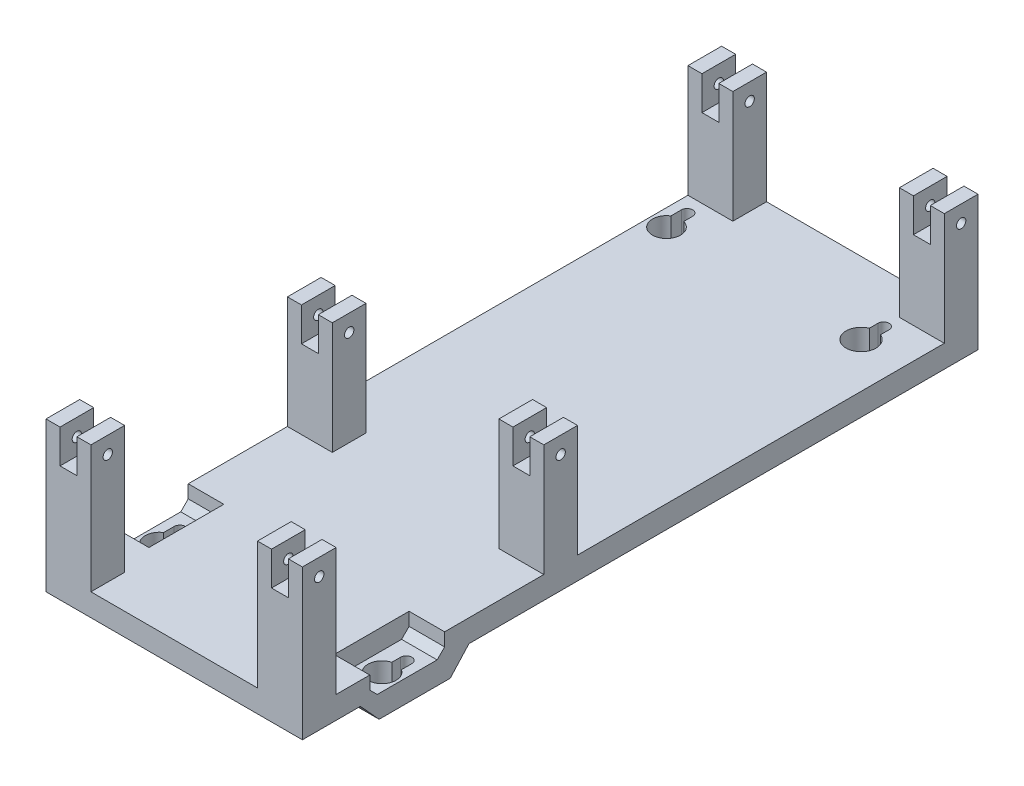
from build123d import *
from OCP.BRepFilletAPI import BRepFilletAPI_MakeChamfer

# Parameters (mm, degrees)
SKETCH1_W           = 68.5
SKETCH1_H           = 64.5
BOSS_EXTRUDE3_DEPTH = 21
SKETCH3_W           = 61.5
SKETCH3_H           = 61
CUT_EXTRUDE1_DEPTH  = 15
SKETCH5_W           = 68.5
SKETCH5_H           = 6
BOSS_EXTRUDE4_DEPTH = 105
SKETCH10_W          = 10
SKETCH10_H          = 29
BOSS_EXTRUDE5_DEPTH = 5.5
SKETCH9_W           = 3.5
SKETCH9_H           = 20
CUT_EXTRUDE2_DEPTH  = 20.5
SKETCH11_W          = 6
SKETCH11_H          = 20
CUT_EXTRUDE3_DEPTH  = 5.5
CHAMFER2_SIZE       = 5.5
CHAMFER2_SIZE_2     = 5
CHAMFER3_SIZE       = 2
SKETCH12_W          = 34.25
SKETCH12_H          = 169.5
CUT_EXTRUDE4_DEPTH  = 50
SKETCH15_R          = 1.5
CUT_EXTRUDE5_DEPTH  = 50
SKETCH19_W          = 34.25
SKETCH19_H          = 6
BOSS_EXTRUDE6_DEPTH = 11
SKETCH26_W          = 12
SKETCH26_H          = 9
BOSS_EXTRUDE7_DEPTH = 30
SKETCH20_R          = 3.75
CUT_EXTRUDE9_DEPTH  = 188.119113134
SKETCH21_W          = 3
SKETCH21_H          = 2.806985986
CUT_EXTRUDE10_DEPTH = 188.119113134
SKETCH18_R          = 1.5
CUT_EXTRUDE8_DEPTH  = 135
SKETCH24_R          = 4
CUT_EXTRUDE13_DEPTH = 196.377839071
SKETCH25_W          = 3
SKETCH25_H          = 3.218590937
CUT_EXTRUDE14_DEPTH = 196.377839071
SKETCH33_R          = 1.5
CUT_EXTRUDE17_DEPTH = 9.74
SKETCH34_R          = 3.75
CUT_EXTRUDE18_DEPTH = 196.377839071
SKETCH39_W          = 3
SKETCH39_H          = 4.471117771
CUT_EXTRUDE22_DEPTH = 196.377839071
CUT_EXTRUDE23_DEPTH = 15
SKETCH41_W          = 4.5
SKETCH41_H          = 9
CUT_EXTRUDE24_DEPTH = 9
SKETCH42_R          = 1.25
CUT_EXTRUDE25_DEPTH = 197.388645293
SKETCH43_W          = 12
SKETCH43_H          = 9
BOSS_EXTRUDE8_DEPTH = 4
SKETCH44_W          = 4.5
SKETCH44_H          = 9
CUT_EXTRUDE26_DEPTH = 9
SKETCH45_R          = 1.25
CUT_EXTRUDE27_DEPTH = 198.16110164


with BuildPart() as part:
    # Sketch1 → Boss-Extrude3 (new body)
    with BuildSketch(Plane(origin=(0, 0, 0), x_dir=(1, 0, 0), z_dir=(0, 1, 0))):
        with Locations((-34.25, 32.25)):
            Rectangle(SKETCH1_W, SKETCH1_H)
    extrude(amount=BOSS_EXTRUDE3_DEPTH)

    # Sketch3 → Cut-Extrude1 (cut)
    with BuildSketch(Plane(origin=(0, 21, 0), x_dir=(1, 0, 0), z_dir=(0, 1, 0))):
        with Locations((-34.25, 34)):
            Rectangle(SKETCH3_W, SKETCH3_H)
    extrude(amount=-CUT_EXTRUDE1_DEPTH, mode=Mode.SUBTRACT)

    # Sketch5 → Boss-Extrude4 (add)
    with BuildSketch(Plane(origin=(0, 0, -64.5), x_dir=(-1, 0, 0), z_dir=(0, 0, -1))):
        with Locations((34.25, 3)):
            Rectangle(SKETCH5_W, SKETCH5_H)
    extrude(amount=BOSS_EXTRUDE4_DEPTH)

    # Sketch10 → Boss-Extrude5 (add)
    with BuildSketch(Plane.XZ):
        with Locations((-5, -30)):
            Rectangle(SKETCH10_W, SKETCH10_H)
    extrude(amount=BOSS_EXTRUDE5_DEPTH)

    # Sketch9 → Cut-Extrude2 (cut)
    with BuildSketch(Plane(origin=(0, 21, 0), x_dir=(1, 0, 0), z_dir=(0, 1, 0))):
        with Locations((-1.75, 28)):
            Rectangle(SKETCH9_W, SKETCH9_H)
    extrude(amount=-CUT_EXTRUDE2_DEPTH, mode=Mode.SUBTRACT)

    # Sketch11 → Cut-Extrude3 (cut)
    with BuildSketch(Plane(origin=(0, 6, 0), x_dir=(1, 0, 0), z_dir=(0, 1, 0))):
        with Locations((-6.5, 28)):
            Rectangle(SKETCH11_W, SKETCH11_H)
    extrude(amount=-CUT_EXTRUDE3_DEPTH, mode=Mode.SUBTRACT)

    # Chamfer2
    chamfer2_edges_1 = [part.edges().sort_by_distance(p)[0] for p in [
        (-5, -5.5, -44.5),
    ]]
    chamfer2_side_1 = [part.faces().sort_by_distance(p)[0] for p in [
        (-5, -5.4, -44.5),
    ]]
    chamfer2_edges_2 = [part.edges().sort_by_distance(p)[0] for p in [
        (-5, -5.5, -15.5),
    ]]
    chamfer2_side_2 = [part.faces().sort_by_distance(p)[0] for p in [
        (-5, -5.5, -15.6),
    ]]
    chamfer2 = BRepFilletAPI_MakeChamfer(part.part.solid().wrapped)
    for e in chamfer2_edges_1:
        chamfer2.Add(CHAMFER2_SIZE - 0.0001, CHAMFER2_SIZE_2 - 0.0001, e.wrapped, chamfer2_side_1[0].wrapped)
    for e in chamfer2_edges_2:
        chamfer2.Add(CHAMFER2_SIZE_2 - 0.0001, CHAMFER2_SIZE - 0.0001, e.wrapped, chamfer2_side_2[0].wrapped)
    add(Compound.cast(chamfer2.Shape()), mode=Mode.REPLACE)  # a hair under: the kernel refuses the full size

    # Chamfer3
    chamfer3_edges = [part.edges().sort_by_distance(p)[0] for p in [
        (-4.75, 0.5, -38),
        (-4.75, 0.5, -18),
    ]]
    chamfer(chamfer3_edges, length=CHAMFER3_SIZE)

    # Sketch12 → Cut-Extrude4 (cut)
    with BuildSketch(Plane(origin=(0, 21, 0), x_dir=(1, 0, 0), z_dir=(0, 1, 0))):
        with Locations((-51.375, 84.75)):
            Rectangle(SKETCH12_W, SKETCH12_H)
    extrude(amount=-CUT_EXTRUDE4_DEPTH, mode=Mode.SUBTRACT)

    # Sketch15 → Cut-Extrude5 (cut)
    with BuildSketch(Plane(origin=(0, 0.5, 0), x_dir=(1, 0, 0), z_dir=(0, 1, 0))):
        with Locations(Location((-4, 31.75713966, 0), (0, 0, 270))):
            Circle(SKETCH15_R)
    extrude(amount=-CUT_EXTRUDE5_DEPTH, mode=Mode.SUBTRACT)

    # Sketch19 → Boss-Extrude6 (add)
    with BuildSketch(Plane(origin=(0, 0, -169.5), x_dir=(-1, 0, 0), z_dir=(0, 0, -1))):
        with Locations((17.125, 3)):
            Rectangle(SKETCH19_W, SKETCH19_H)
    extrude(amount=BOSS_EXTRUDE6_DEPTH)

    # Sketch26 → Boss-Extrude7 (add)
    with BuildSketch(Plane(origin=(0, 6, 0), x_dir=(1, 0, 0), z_dir=(0, 1, 0))):
        with Locations((-6, 69)):
            Rectangle(SKETCH26_W, SKETCH26_H)
        with Locations((-6, 4.5)):
            Rectangle(SKETCH26_W, SKETCH26_H)
        with Locations((-6, 176)):
            Rectangle(SKETCH26_W, SKETCH26_H)
    extrude(amount=BOSS_EXTRUDE7_DEPTH)

    # Sketch20 → Cut-Extrude9 (cut, through all)
    with BuildSketch(Plane(origin=(0, 0.5, 0), x_dir=(1, 0, 0), z_dir=(0, 1, 0))):
        with Locations(Location((-4.5, 25.778009288, 0), (0, 0, 270))):
            Circle(SKETCH20_R)
    extrude(amount=-CUT_EXTRUDE9_DEPTH, mode=Mode.SUBTRACT)

    # Sketch21 → Cut-Extrude10 (cut, through all)
    with BuildSketch(Plane(origin=(0, 0.5, 0), x_dir=(1, 0, 0), z_dir=(0, 1, 0))):
        with Locations((-4, 30.353646667)):
            Rectangle(SKETCH21_W, SKETCH21_H)
    extrude(amount=-CUT_EXTRUDE10_DEPTH, mode=Mode.SUBTRACT)

    # Mirror5: part across plane


with BuildPart() as part_1:
    add(part.part)
    add(part.part.mirror(Plane(origin=(-34.25, 0, 0), x_dir=(0, 0, 1), z_dir=(1, 0, 0))))

    # Sketch18 → Cut-Extrude8 (cut)
    with BuildSketch(Plane(origin=(0, 6, 0), x_dir=(1, 0, 0), z_dir=(0, 1, 0))):
        with Locations(Location((-12, 167.25713966, 0), (0, 0, 270))):
            Circle(SKETCH18_R)
    extrude(amount=-CUT_EXTRUDE8_DEPTH, mode=Mode.SUBTRACT)

    # Sketch24 → Cut-Extrude13 (cut, through all)
    with BuildSketch(Plane(origin=(0, 6, 0), x_dir=(1, 0, 0), z_dir=(0, 1, 0))):
        with Locations(Location((-12, 161.25713966, 0), (0, 0, 270))):
            Circle(SKETCH24_R)
    extrude(amount=-CUT_EXTRUDE13_DEPTH, mode=Mode.SUBTRACT)

    # Sketch25 → Cut-Extrude14 (cut, through all)
    with BuildSketch(Plane(origin=(0, 6, 0), x_dir=(1, 0, 0), z_dir=(0, 1, 0))):
        with Locations((-12, 165.647844192)):
            Rectangle(SKETCH25_W, SKETCH25_H)
    extrude(amount=-CUT_EXTRUDE14_DEPTH, mode=Mode.SUBTRACT)

    # Sketch33 → Cut-Extrude17 (cut)
    with BuildSketch(Plane(origin=(0, 6, 0), x_dir=(1, 0, 0), z_dir=(0, 1, 0))):
        with Locations(Location((-64.5, 167.25713966, 0), (0, 0, 270))):
            Circle(SKETCH33_R)
        with Locations((-64.5, 31.75713966)):
            Circle(SKETCH33_R)
        with Locations((-12, 167.25713966)):
            Circle(SKETCH33_R)
    extrude(amount=-CUT_EXTRUDE17_DEPTH, mode=Mode.SUBTRACT)

    # Sketch34 → Cut-Extrude18 (cut, through all)
    with BuildSketch(Plane(origin=(0, 6, 0), x_dir=(1, 0, 0), z_dir=(0, 1, 0))):
        with Locations(Location((-64, 161.278009288, 0), (0, 0, 270))):
            Circle(SKETCH34_R)
    extrude(amount=-CUT_EXTRUDE18_DEPTH, mode=Mode.SUBTRACT)

    # Sketch39 → Cut-Extrude22 (cut, through all)
    with BuildSketch(Plane(origin=(0, 6, 0), x_dir=(1, 0, 0), z_dir=(0, 1, 0))):
        with Locations((-64.5, 165.021580775)):
            Rectangle(SKETCH39_W, SKETCH39_H)
    extrude(amount=-CUT_EXTRUDE22_DEPTH, mode=Mode.SUBTRACT)

    # Sketch40 → Cut-Extrude23 (cut)
    with BuildSketch(Plane(origin=(0, 21, 0), x_dir=(1, 0, 0), z_dir=(0, 1, 0))):
        Polygon((-68.5, 64.5), (-68.5, 9), (-56.5, 9), (-56.5, 0), (-12, 0), (-12, 9), (0, 9), (0, 64.5), align=None)
    extrude(amount=-CUT_EXTRUDE23_DEPTH, mode=Mode.SUBTRACT)

    # Sketch41 → Cut-Extrude24 (cut)
    with BuildSketch(Plane(origin=(0, 36, 0), x_dir=(1, 0, 0), z_dir=(0, 1, 0))):
        with Locations((-62.5, 69)):
            Rectangle(SKETCH41_W, SKETCH41_H)
        with Locations((-62.5, 176)):
            Rectangle(SKETCH41_W, SKETCH41_H)
        with Locations((-6, 69)):
            Rectangle(SKETCH41_W, SKETCH41_H)
        with Locations((-6, 176)):
            Rectangle(SKETCH41_W, SKETCH41_H)
    extrude(amount=-CUT_EXTRUDE24_DEPTH, mode=Mode.SUBTRACT)

    # Sketch42 → Cut-Extrude25 (cut, through all)
    with BuildSketch(Plane(origin=(0, 0, 0), x_dir=(0, 0, -1), z_dir=(1, 0, 0))):
        with Locations((69, 31.5)):
            Circle(SKETCH42_R)
        with Locations((176, 31.5)):
            Circle(SKETCH42_R)
    extrude(amount=-CUT_EXTRUDE25_DEPTH, mode=Mode.SUBTRACT)

    # Sketch43 → Boss-Extrude8 (add)
    with BuildSketch(Plane(origin=(0, 36, 0), x_dir=(1, 0, 0), z_dir=(0, 1, 0))):
        with Locations((-62.5, 4.5)):
            Rectangle(SKETCH43_W, SKETCH43_H)
        with Locations((-6, 4.5)):
            Rectangle(SKETCH43_W, SKETCH43_H)
    extrude(amount=BOSS_EXTRUDE8_DEPTH)

    # Sketch44 → Cut-Extrude26 (cut)
    with BuildSketch(Plane(origin=(0, 40, 0), x_dir=(1, 0, 0), z_dir=(0, 1, 0))):
        with Locations((-62.5, 4.5)):
            Rectangle(SKETCH44_W, SKETCH44_H)
        with Locations((-6, 4.5)):
            Rectangle(SKETCH44_W, SKETCH44_H)
    extrude(amount=-CUT_EXTRUDE26_DEPTH, mode=Mode.SUBTRACT)

    # Sketch45 → Cut-Extrude27 (cut, through all)
    with BuildSketch(Plane(origin=(0, 0, 0), x_dir=(0, 0, -1), z_dir=(1, 0, 0))):
        with Locations((4.5, 35.5)):
            Circle(SKETCH45_R)
    extrude(amount=-CUT_EXTRUDE27_DEPTH, mode=Mode.SUBTRACT)


solid = part_1.part
